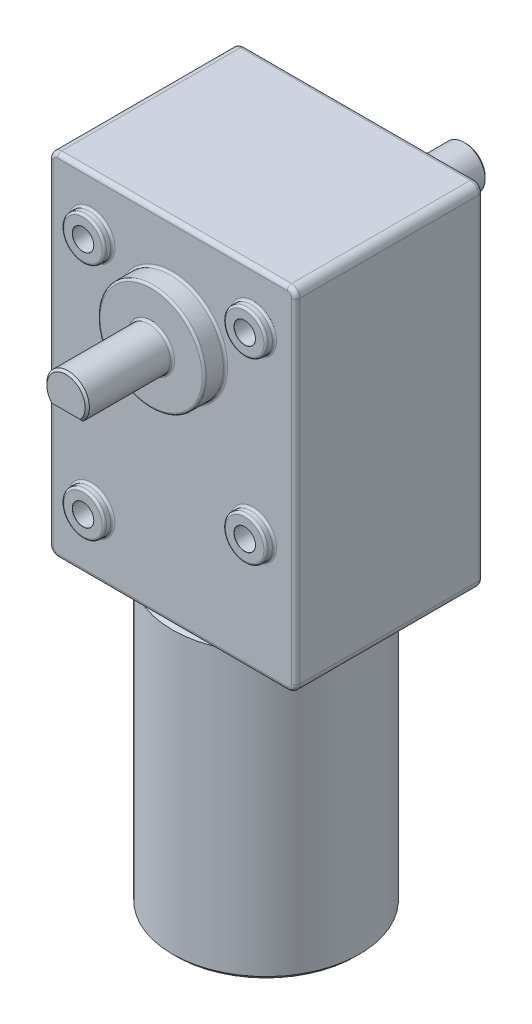
from build123d import *

# Parameters (mm, degrees)
SKETCH1_W                         = 58
SKETCH1_H                         = 82.5
BOSS_EXTRUDE1_DEPTH               = 22
BOSS_EXTRUDE2_START               = -22
SKETCH2_R                         = 12.5
BOSS_EXTRUDE2_DEPTH               = 27
SKETCH3_R                         = 5
BOSS_EXTRUDE3_DEPTH               = 20
SKETCH4_W                         = 15
SKETCH4_H                         = 1.5
CUT_EXTRUDE1_DEPTH                = 69.931578395
SKETCH5_R                         = 5
BOSS_EXTRUDE4_DEPTH               = 2
F_5_0_5_DIAMETER_HOLE1_AT_2_COUNT = 2
F_5_0_5_DIAMETER_HOLE1_AT_2_PITCH = 42
F_5_0_5_DIAMETER_HOLE1_AT_3_COUNT = 2
F_5_0_5_DIAMETER_HOLE1_AT_3_PITCH = 67.675697263
F_5_0_5_DIAMETER_HOLE1_AT_4_COUNT = 2
F_5_0_5_DIAMETER_HOLE1_AT_4_PITCH = 38
CHAMFER1_SIZE                     = 0.5
CHAMFER1_OF_MIRROR3_SIZE          = 0.5
FILLET1_R                         = 0.5
FILLET3_R                         = 1
FILLET4_R                         = 2
SKETCH10_R                        = 22
BOSS_EXTRUDE5_DEPTH               = 68
CHAMFER2_SIZE                     = 1


with BuildPart() as part:
    # Sketch1 → Boss-Extrude1 (new, symmetric)
    with BuildSketch(Plane.XY):
        Rectangle(SKETCH1_W, SKETCH1_H)
    extrude(amount=BOSS_EXTRUDE1_DEPTH, both=True)

    # Sketch2 → Boss-Extrude2 (add, symmetric)
    with BuildSketch(Plane.XY.offset(22).offset(BOSS_EXTRUDE2_START)):
        with Locations((0, 17.75)):
            Circle(SKETCH2_R)
    extrude(amount=BOSS_EXTRUDE2_DEPTH, both=True)

    # Sketch3 → Boss-Extrude3 (add)
    with BuildSketch(Plane.XY.offset(27)):
        with Locations((0, 17.75)):
            Circle(SKETCH3_R)
    boss_extrude3 = extrude(amount=BOSS_EXTRUDE3_DEPTH)

    # Sketch4 → Cut-Extrude1 (cut, symmetric)
    with BuildSketch(Plane(origin=(0, 0, 0), x_dir=(0, 0, -1), z_dir=(1, 0, 0))):
        with Locations((-39.5, 13.5)):
            Rectangle(SKETCH4_W, SKETCH4_H)
    cut_extrude1 = extrude(amount=CUT_EXTRUDE1_DEPTH, both=True, mode=Mode.SUBTRACT)

    # Sketch5 → Boss-Extrude4 (add)
    with BuildSketch(Plane.XY.offset(22)):
        with Locations((-19, 28.75)):
            Circle(SKETCH5_R)
        with Locations(Location((19, 28.75, 0), (0, 0, 180))):
            Circle(SKETCH5_R)
        with Locations((-19, -27.25)):
            Circle(SKETCH5_R)
        with Locations((19, -13.25)):
            Circle(SKETCH5_R)
    boss_extrude4 = extrude(amount=BOSS_EXTRUDE4_DEPTH)

    # Sketch9 → Ø5.0 (5) Diameter Hole1 (revolve, cut)
    with BuildSketch(Plane(origin=(19, 28.75, 24), x_dir=(0, -1, 0), z_dir=(1, 0, 0))):
        Polygon((0, 0), (0, 11.502151548), (2.5, 10), (2.5, 0.025), (2.525, 0), align=None)
    f_5_0_5_diameter_hole1 = revolve(axis=Axis((19, 28.75, 30.35), (0, 0, -1)), mode=Mode.SUBTRACT)

    # Ø5.0 (5) Diameter Hole1 at 2: Ø5.0 (5) Diameter Hole1 ×2
    with Locations(*[(0, -i * F_5_0_5_DIAMETER_HOLE1_AT_2_PITCH, 0) for i in range(1, F_5_0_5_DIAMETER_HOLE1_AT_2_COUNT)]):
        add(f_5_0_5_diameter_hole1, mode=Mode.SUBTRACT)

    # Ø5.0 (5) Diameter Hole1 at 3: Ø5.0 (5) Diameter Hole1 ×2
    with Locations(*[Vector(-0.5615014183372646, -0.8274757743917585, 0) * (i * F_5_0_5_DIAMETER_HOLE1_AT_3_PITCH) for i in range(1, F_5_0_5_DIAMETER_HOLE1_AT_3_COUNT)]):
        add(f_5_0_5_diameter_hole1, mode=Mode.SUBTRACT)

    # Ø5.0 (5) Diameter Hole1 at 4: Ø5.0 (5) Diameter Hole1 ×2
    with Locations(*[(-i * F_5_0_5_DIAMETER_HOLE1_AT_4_PITCH, 0, 0) for i in range(1, F_5_0_5_DIAMETER_HOLE1_AT_4_COUNT)]):
        add(f_5_0_5_diameter_hole1, mode=Mode.SUBTRACT)

    # Chamfer1
    chamfer1_edges = [part.edges().sort_by_distance(p)[0] for p in [
        (-1.890294809, 22.378907596, 47),
        (0, 14.25, 47),
    ]]
    chamfer(chamfer1_edges, length=CHAMFER1_SIZE)

    # Mirror3: Boss-Extrude3, Cut-Extrude1, Boss-Extrude4, Ø5.0 (5) Diameter Hole1 across plane
    add(boss_extrude3.mirror(Plane.XY))
    add(cut_extrude1.mirror(Plane.XY), mode=Mode.SUBTRACT)
    add(boss_extrude4.mirror(Plane.XY))
    add(f_5_0_5_diameter_hole1.mirror(Plane.XY), mode=Mode.SUBTRACT)

    # Mirror3 copy 1 sketch → Mirror3 copy 1 (revolve, cut)
    with BuildSketch(Plane(origin=(19, -13.25, -24), x_dir=(0, -1, 0), z_dir=(1, 0, 0))):
        Polygon((0, 0), (0, -11.502151548), (2.5, -10), (2.5, -0.025), (2.525, 0), align=None)
    revolve(axis=Axis((19, -13.25, -30.35), (0, 0, -1)), mode=Mode.SUBTRACT)

    # Mirror3 copy 2 sketch → Mirror3 copy 2 (revolve, cut)
    with BuildSketch(Plane(origin=(-19, -27.25, -24), x_dir=(0, -1, 0), z_dir=(1, 0, 0))):
        Polygon((0, 0), (0, -11.502151548), (2.5, -10), (2.5, -0.025), (2.525, 0), align=None)
    revolve(axis=Axis((-19, -27.25, -30.35), (0, 0, -1)), mode=Mode.SUBTRACT)

    # Mirror3 copy 3 sketch → Mirror3 copy 3 (revolve, cut)
    with BuildSketch(Plane(origin=(-19, 28.75, -24), x_dir=(0, -1, 0), z_dir=(1, 0, 0))):
        Polygon((0, 0), (0, -11.502151548), (2.5, -10), (2.5, -0.025), (2.525, 0), align=None)
    revolve(axis=Axis((-19, 28.75, -30.35), (0, 0, -1)), mode=Mode.SUBTRACT)

    # Chamfer1 of Mirror3
    chamfer1_of_mirror3_edges = [part.edges().sort_by_distance(p)[0] for p in [
        (-1.890294809, 22.378907596, -47),
        (0, 14.25, -47),
    ]]
    chamfer(chamfer1_of_mirror3_edges, length=CHAMFER1_OF_MIRROR3_SIZE)

    # Fillet1
    fillet1_edges = [part.edges().sort_by_distance(p)[0] for p in [
        (-24, 28.75, -24),
        (-24, 28.75, -22),
        (24, 28.75, -24),
        (24, 28.75, -22),
        (-24, -27.25, -24),
        (-24, -27.25, -22),
        (14, -13.25, -24),
        (14, -13.25, -22),
        (-12.5, 17.75, -22),
        (-12.5, 17.75, 22),
        (-12.5, 17.75, -27),
        (-12.5, 17.75, 27),
        (-5, 17.75, 27),
        (-24, 28.75, 22),
        (-24, 28.75, 24),
        (24, 28.75, 22),
        (24, 28.75, 24),
        (-24, -27.25, 22),
        (-24, -27.25, 24),
        (14, -13.25, 22),
        (14, -13.25, 24),
        (-5, 17.75, -27),
    ]]
    fillet(fillet1_edges, radius=FILLET1_R)

    # Fillet3
    fillet3_edges = [part.edges().sort_by_distance(p)[0] for p in [
        (0, 41.25, 22),
        (-29, 0, 22),
        (0, -41.25, 22),
        (-29, 0, -22),
        (0, 41.25, -22),
        (29, 0, -22),
        (0, -41.25, -22),
        (29, 0, 22),
    ]]
    fillet(fillet3_edges, radius=FILLET3_R)

    # Fillet4
    # the kernel refuses this fillet: 2 mm, written as the material it adds along each edge
    with BuildSketch(Plane(origin=(19, 28.75, -14), x_dir=(0, -1, 0), z_dir=(1, 0, 0))) as fillet4_piece_1:
        with BuildLine():
            CenterArc((2.5 - FILLET4_R, FILLET4_R * 0.565772778188), FILLET4_R, 301, 59)
            Line((2.5 - FILLET4_R * 0.48496192509, -FILLET4_R * 0.291394522514), (2.5, 0))
            Line((2.5, 0), (2.5, FILLET4_R * 0.565772778188))
        make_face()
    revolve(axis=Axis((19, 28.75, -14), (0, 0, -1)))
    # the kernel refuses this fillet: 2 mm, written as the material it takes off along each edge
    with BuildSketch(Plane(origin=(-27, -39.25, -22), x_dir=(0, -1, 0), z_dir=(1, 0, 0))) as fillet4_2_piece_1:
        with BuildLine():
            CenterArc((1, -1), 1, 0, 90)
            Line((2, -1), (2, 0))
            Line((2, 0), (1, 0))
        make_face()
    revolve(axis=Axis((-27, -39.25, -22), (0, 0, -1)), revolution_arc=90, mode=Mode.SUBTRACT)
    with BuildSketch(Plane(origin=(-27, 39.25, -22), x_dir=(-1, 0, 0), z_dir=(0, -1, 0))) as fillet4_2_piece_2:
        with BuildLine():
            CenterArc((1, -1), 1, 0, 90)
            Line((2, -1), (2, 0))
            Line((2, 0), (1, 0))
        make_face()
    revolve(axis=Axis((-27, 39.25, -22), (0, 0, -1)), revolution_arc=90, mode=Mode.SUBTRACT)
    with BuildSketch(Plane(origin=(27, -39.25, -22), x_dir=(1, 0, 0), z_dir=(0, 1, 0))) as fillet4_2_piece_3:
        with BuildLine():
            CenterArc((1, -1), 1, 0, 90)
            Line((2, -1), (2, 0))
            Line((2, 0), (1, 0))
        make_face()
    revolve(axis=Axis((27, -39.25, -22), (0, 0, -1)), revolution_arc=90, mode=Mode.SUBTRACT)
    with BuildSketch(Plane(origin=(27, 39.25, -22), x_dir=(0, 1, 0), z_dir=(-1, 0, 0))) as fillet4_2_piece_4:
        with BuildLine():
            CenterArc((1, -1), 1, 0, 90)
            Line((2, -1), (2, 0))
            Line((2, 0), (1, 0))
        make_face()
    revolve(axis=Axis((27, 39.25, -22), (0, 0, -1)), revolution_arc=90, mode=Mode.SUBTRACT)
    with BuildSketch(Plane(origin=(-27, 39.25, 22), x_dir=(0, 1, 0), z_dir=(1, 0, 0))) as fillet4_2_piece_5:
        with BuildLine():
            CenterArc((1, -1), 1, 0, 90)
            Line((2, -1), (2, 0))
            Line((2, 0), (1, 0))
        make_face()
    revolve(axis=Axis((-27, 39.25, 22), (0, 0, 1)), revolution_arc=90, mode=Mode.SUBTRACT)
    with BuildSketch(Plane(origin=(27, 39.25, 22), x_dir=(1, 0, 0), z_dir=(0, -1, 0))) as fillet4_2_piece_6:
        with BuildLine():
            CenterArc((1, -1), 1, 0, 90)
            Line((2, -1), (2, 0))
            Line((2, 0), (1, 0))
        make_face()
    revolve(axis=Axis((27, 39.25, 22), (0, 0, 1)), revolution_arc=90, mode=Mode.SUBTRACT)
    with BuildSketch(Plane(origin=(-27, -39.25, 22), x_dir=(-1, 0, 0), z_dir=(0, 1, 0))) as fillet4_2_piece_7:
        with BuildLine():
            CenterArc((1, -1), 1, 0, 90)
            Line((2, -1), (2, 0))
            Line((2, 0), (1, 0))
        make_face()
    revolve(axis=Axis((-27, -39.25, 22), (0, 0, 1)), revolution_arc=90, mode=Mode.SUBTRACT)
    with BuildSketch(Plane(origin=(27, -39.25, 22), x_dir=(0, -1, 0), z_dir=(-1, 0, 0))) as fillet4_2_piece_8:
        with BuildLine():
            CenterArc((1, -1), 1, 0, 90)
            Line((2, -1), (2, 0))
            Line((2, 0), (1, 0))
        make_face()
    revolve(axis=Axis((27, -39.25, 22), (0, 0, 1)), revolution_arc=90, mode=Mode.SUBTRACT)
    with BuildSketch(Plane(origin=(29, 41.25, -22), x_dir=(-1, 0, 0), z_dir=(0, 0, 1)), Plane(origin=(-29, -41.25, 22), x_dir=(0, 1, 0), z_dir=(0, 0, -1))) as fillet4_2_piece_9:
        with BuildLine():
            CenterArc((FILLET4_R, FILLET4_R), FILLET4_R, 180, 90)
            Line((0, FILLET4_R), (0, 0))
            Line((0, 0), (FILLET4_R, 0))
        make_face()
    extrude(amount=44, mode=Mode.SUBTRACT)
    with BuildSketch(Plane(origin=(29, -41.25, -22), x_dir=(-1, 0, 0), z_dir=(0, 0, 1)), Plane(origin=(-29, 41.25, 22), x_dir=(0, -1, 0), z_dir=(0, 0, -1))) as fillet4_2_piece_10:
        with BuildLine():
            CenterArc((FILLET4_R, -FILLET4_R), FILLET4_R, 90, 90)
            Line((0, -FILLET4_R), (0, 0))
            Line((0, 0), (FILLET4_R, 0))
        make_face()
    extrude(amount=44, mode=Mode.SUBTRACT)


with BuildPart() as body_2:
    # Sketch10 → Boss-Extrude5 (new body)
    with BuildSketch(Plane.XZ.offset(41.25)):
        with Locations(Location((0, 0, 0), (0, 0, 270))):
            Circle(SKETCH10_R)
    extrude(amount=BOSS_EXTRUDE5_DEPTH)

    # Chamfer2
    chamfer2_edges = [body_2.edges().sort_by_distance(p)[0] for p in [
        (0, -41.25, 22),
        (0, -109.25, 22),
    ]]
    chamfer(chamfer2_edges, length=CHAMFER2_SIZE)


solid = Compound([part.part, body_2.part])
